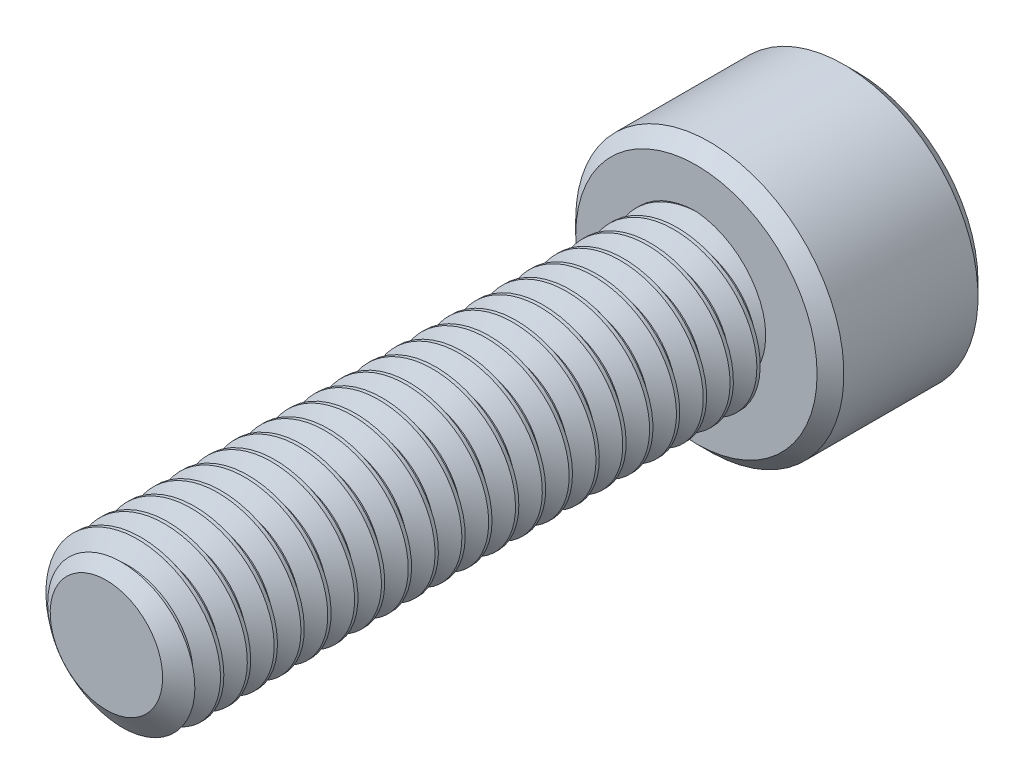
from build123d import *

# Parameters (mm, degrees)
SKETCH1_R          = 3
EXTRUDE1_DEPTH     = 22
CUT_SWEEP1_PITCH   = 1
SKETCH6_R          = 5
EXTRUDE2_DEPTH     = 6
CUT_EXTRUDE1_DEPTH = 3.75
CHAMFER1_SIZE      = 0.5


with BuildPart() as part:
    # Sketch1 → Extrude1 (new body)
    with BuildSketch(Plane.XY):
        Circle(SKETCH1_R)
    extrude(amount=-EXTRUDE1_DEPTH)

    # Cut-Sweep1: the profile of Sketch3 profile screwed along a right-hand helix of 23 turns, 6 arcs to a turn; built about Z, then put on its axis
    cut_sweep1_z = Axis((0, 0, 0), (0, 0, 1))
    cut_sweep1_corners = [(3.0003, 0, -0.875173205), (2.350480947, 0, -0.5), (2.350480947, 0, -0.375), (3.0003, 0, 0.000173205)]
    with BuildLine(mode=Mode.PRIVATE) as cut_sweep1_profile:
        Line(cut_sweep1_corners[0], cut_sweep1_corners[1])
        Line(cut_sweep1_corners[1], cut_sweep1_corners[2])
        Line(cut_sweep1_corners[2], cut_sweep1_corners[3])
        Line(cut_sweep1_corners[3], cut_sweep1_corners[0])
    cut_sweep1_cap = Face(cut_sweep1_profile.wire())
    cut_sweep1_turn_angles = [0, 30, 60, 90, 120, 150, 180, 210, 240, 270, 300, 330, 360]
    cut_sweep1_turn_weights = [1, 0.8660254037844387, 1, 0.8660254037844387, 1, 0.8660254037844387, 1, 0.8660254037844387, 1, 0.8660254037844387, 1, 0.8660254037844387, 1]
    cut_sweep1_turn_rails = [Edge.make_bspline([Vector(p[0], p[1], 0).rotate(cut_sweep1_z, cut_sweep1_turn_angles[k]) / cut_sweep1_turn_weights[k] + Vector(0, 0, p[2] + CUT_SWEEP1_PITCH * cut_sweep1_turn_angles[k] / 360) for k in range(13)], [0, 0, 0, 1, 1, 2, 2, 3, 3, 4, 4, 5, 5, 6, 6, 6], 2, cut_sweep1_turn_weights) for p in cut_sweep1_corners]
    cut_sweep1_turn_sides = [Face.make_surface_from_curves(cut_sweep1_turn_rails[p[0]], cut_sweep1_turn_rails[p[1]]) for p in [(0, 1), (1, 2), (2, 3), (3, 0)]]
    cut_sweep1 = Plane(origin=(0, 0, 0), x_dir=(0, 1, 0), z_dir=(0, 0, -1)) * Solid(Shell([*[p.moved(Location((0, 0, CUT_SWEEP1_PITCH * i))) for i in range(23) for p in cut_sweep1_turn_sides], cut_sweep1_cap, cut_sweep1_cap.rotate(cut_sweep1_z, 8280).moved(Location((0, 0, CUT_SWEEP1_PITCH * 8280 / 360)))]))
    add(cut_sweep1, mode=Mode.SUBTRACT)

    # Sketch4 → Cut-Revolve1 (revolve, cut)
    with BuildSketch(Plane(origin=(0, 0, 0), x_dir=(0, 0, -1), z_dir=(1, 0, 0)), mode=Mode.PRIVATE) as cut_revolve1_sk:
        Polygon((0.632650852, 3), (0, 2.096480947), (0, 3), align=None)
    revolve(cut_revolve1_sk.sketch.rotate(Axis((0, 0, 0), (0, 0, -1)), 270), axis=Axis((0, 0, 0), (0, 0, -1)), mode=Mode.SUBTRACT)

    # Sketch6 → Extrude2 (add)
    with BuildSketch(Plane(origin=(0, 0, -22), x_dir=(-1, 0, 0), z_dir=(0, 0, -1))):
        Circle(SKETCH6_R)
    extrude(amount=EXTRUDE2_DEPTH)

    # Sketch7 → Cut-Extrude1 (cut)
    with BuildSketch(Plane(origin=(0, 0, -28), x_dir=(-1, 0, 0), z_dir=(0, 0, -1))):
        Polygon((0, 2.886751346), (-2.5, 1.443375673), (-2.5, -1.443375673), (0, -2.886751346), (2.5, -1.443375673), (2.5, 1.443375673), align=None)
    extrude(amount=-CUT_EXTRUDE1_DEPTH, mode=Mode.SUBTRACT)

    # Cut-Extrude2 cone 1 section (through the dimple's axis) → Cut-Extrude2 (revolve, cut)
    with BuildSketch(Plane(origin=(0, 0, -28), x_dir=(0, 1, 0), z_dir=(1, 0, 0))):
        Polygon((0, 0), (2.886751346, 0), (0, 2.886751346), align=None)
    revolve(axis=Axis((0, 0, -28), (0, 0, 1)), mode=Mode.SUBTRACT)

    # Chamfer1
    chamfer1_edges = [part.edges().sort_by_distance(p)[0] for p in [
        (5, 0, -22),
        (5, 0, -28),
    ]]
    chamfer(chamfer1_edges, length=CHAMFER1_SIZE)


solid = part.part
